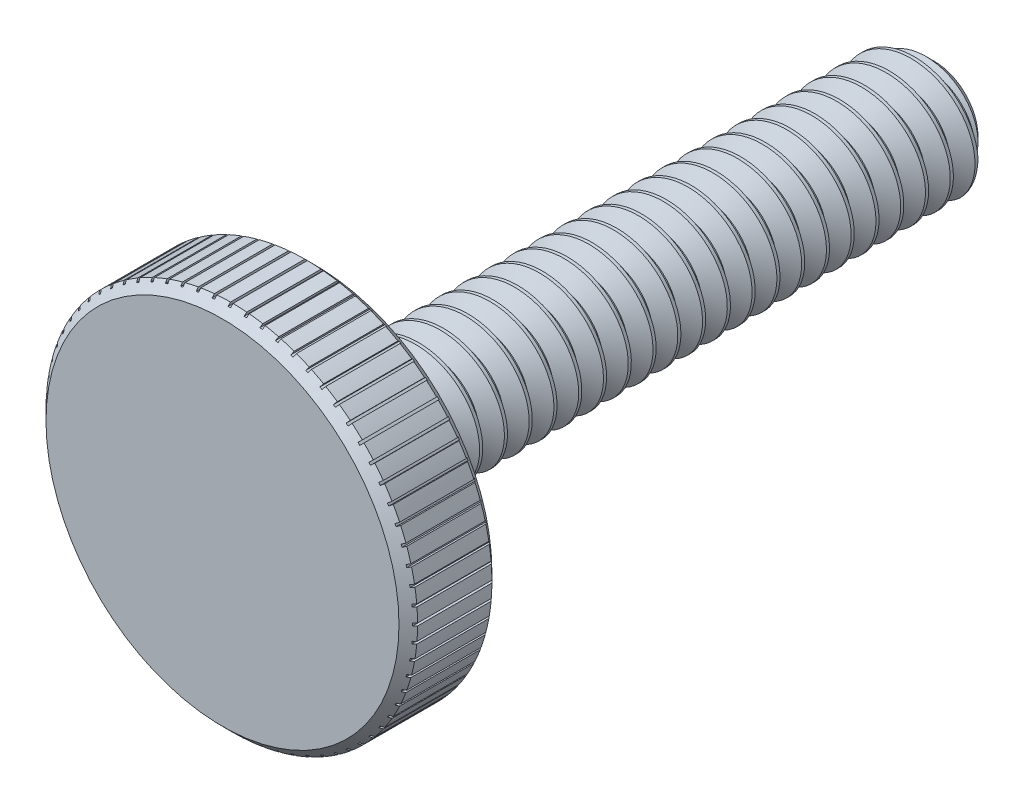
from build123d import *

# Parameters (mm, degrees)
SKETCH1_R               = 3.175
EXTRUDE1_DEPTH          = 31.75
CHAMFER2_SIZE           = 0.9525
CUT_SWEEP1_PITCH        = 1.27
SKETCH21_R              = 9.525
BOSS_EXTRUDE1_DEPTH     = 4.7625
CHAMFER3_SIZE           = 0.47625
CUT_EXTRUDE1_REACH      = 40.232
CUT_EXTRUDE1_END_RADIUS = 9.525
SKETCH22_W              = 0.127
SKETCH22_H              = 4.7625
CIRPATTERN1_COUNT       = 72


with BuildPart() as part:
    # Sketch1 → Extrude1 (new body)
    with BuildSketch(Plane.XY):
        Circle(SKETCH1_R)
    extrude(amount=-EXTRUDE1_DEPTH)

    # Chamfer2
    chamfer2_edges = [part.edges().sort_by_distance(p)[0] for p in [
        (-3.175, 0, -31.75),
    ]]
    chamfer(chamfer2_edges, length=CHAMFER2_SIZE)

    # Cut-Sweep1: arcs per turn and ends read off the stored shape
    # Cut-Sweep1: the profile of Sketch14 profile screwed along a right-hand helix through 26 turns, 8 arcs to a turn; built about Z, then put on its axis
    cut_sweep1_z = Axis((0, 0, 0), (0, 0, 1))
    cut_sweep1_corners = [(3.1753, 0, 0.000173205), (3.1753, 0, -1.111423205), (2.350110803, 0, -0.635), (2.350110803, 0, -0.47625)]
    with BuildLine(mode=Mode.PRIVATE) as cut_sweep1_profile:
        Line(cut_sweep1_corners[0], cut_sweep1_corners[1])
        Line(cut_sweep1_corners[1], cut_sweep1_corners[2])
        Line(cut_sweep1_corners[2], cut_sweep1_corners[3])
        Line(cut_sweep1_corners[3], cut_sweep1_corners[0])
    cut_sweep1_cap = Face(cut_sweep1_profile.wire())
    cut_sweep1_turn_angles = [0, 22.5, 45, 67.5, 90, 112.5, 135, 157.5, 180, 202.5, 225, 247.5, 270, 292.5, 315, 337.5, 360]
    cut_sweep1_turn_weights = [1, 0.9238795325112867, 1, 0.9238795325112867, 1, 0.9238795325112867, 1, 0.9238795325112867, 1, 0.9238795325112867, 1, 0.9238795325112867, 1, 0.9238795325112867, 1, 0.9238795325112867, 1]
    cut_sweep1_turn_rails = [Edge.make_bspline([Vector(p[0], p[1], 0).rotate(cut_sweep1_z, cut_sweep1_turn_angles[k]) / cut_sweep1_turn_weights[k] + Vector(0, 0, p[2] + CUT_SWEEP1_PITCH * cut_sweep1_turn_angles[k] / 360) for k in range(17)], [0, 0, 0, 1, 1, 2, 2, 3, 3, 4, 4, 5, 5, 6, 6, 7, 7, 8, 8, 8], 2, cut_sweep1_turn_weights) for p in cut_sweep1_corners]
    cut_sweep1_turn_sides = [Face.make_surface_from_curves(cut_sweep1_turn_rails[p[0]], cut_sweep1_turn_rails[p[1]]) for p in [(0, 1), (1, 2), (2, 3), (3, 0)]]
    cut_sweep1 = Plane(origin=(0, 0, -31.75), x_dir=(0, 1, 0), z_dir=(0, 0, 1)) * Solid(Shell([*[p.moved(Location((0, 0, CUT_SWEEP1_PITCH * i))) for i in range(26) for p in cut_sweep1_turn_sides], cut_sweep1_cap, cut_sweep1_cap.rotate(cut_sweep1_z, 9360).moved(Location((0, 0, CUT_SWEEP1_PITCH * 9360 / 360)))]))
    add(cut_sweep1, mode=Mode.SUBTRACT)

    # Sketch21 → Boss-Extrude1 (add)
    with BuildSketch(Plane.XY):
        Circle(SKETCH21_R)
    extrude(amount=BOSS_EXTRUDE1_DEPTH)

    # Chamfer3
    chamfer3_edges = [part.edges().sort_by_distance(p)[0] for p in [
        (-9.525, 0, 0),
        (-9.525, 0, 4.7625),
    ]]
    chamfer(chamfer3_edges, length=CHAMFER3_SIZE)

    # Cut-Extrude1: up to this cylinder (the profile starts outside it)
    cut_extrude1_end = Plane(origin=(0, -0.127, 2.38125), z_dir=(0, 0, -1)) * Cylinder(CUT_EXTRUDE1_END_RADIUS, 100.514, mode=Mode.PRIVATE)
    # Sketch22 → Cut-Extrude1 (cut, up to the surface)
    with BuildSketch(Plane(origin=(0, 9.525, 0), x_dir=(-1, 0, 0), z_dir=(0, 1, 0)), mode=Mode.PRIVATE) as cut_extrude1_sk1:
        with Locations((0, 2.38125)):
            Rectangle(SKETCH22_W, SKETCH22_H)
    cut_extrude1_tool1 = extrude(cut_extrude1_sk1.sketch, amount=-CUT_EXTRUDE1_REACH, mode=Mode.PRIVATE) - cut_extrude1_end
    cut_extrude1 = cut_extrude1_tool1.solids().sort_by_distance((0, 9.525, 2.38125))[0]
    add(cut_extrude1, mode=Mode.SUBTRACT)

    # CirPattern1: Cut-Extrude1 ×72 about axis
    cirpattern1_axis = Axis((0, 0, 0), (0, 0, 1))
    for i in range(1, CIRPATTERN1_COUNT):
        add(cut_extrude1.rotate(cirpattern1_axis, i * 360 / CIRPATTERN1_COUNT), mode=Mode.SUBTRACT)


solid = part.part
